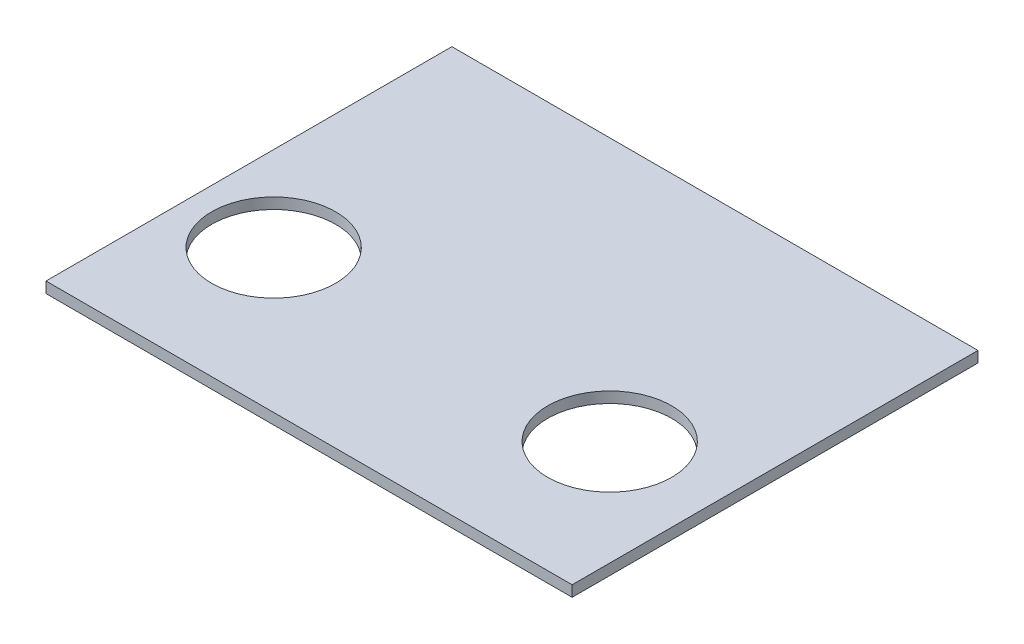
from build123d import *

# Parameters (mm, degrees)
ESQUISSE1_W             = 70
ESQUISSE1_H             = 54
BOSS_EXTRU_1_DEPTH      = 1.45
ESQUISSE2_R             = 8.25
ENL_V_MAT_EXTRU_1_DEPTH = 10
ESQUISSE4_R             = 8.25
ENL_V_MAT_EXTRU_3_DEPTH = 10


with BuildPart() as part:
    # Esquisse1 → Boss.-Extru.1 (new body)
    with BuildSketch(Plane(origin=(0, 0, 0), x_dir=(1, 0, 0), z_dir=(0, 1, 0))):
        Rectangle(ESQUISSE1_W, ESQUISSE1_H)
    extrude(amount=BOSS_EXTRU_1_DEPTH)

    # Esquisse2 → Enlèv. mat.-Extru.1 (cut)
    with BuildSketch(Plane(origin=(0, 1.45, 0), x_dir=(1, 0, 0), z_dir=(0, 1, 0))):
        with Locations((-23.710505548, -8)):
            Circle(ESQUISSE2_R)
    extrude(amount=-ENL_V_MAT_EXTRU_1_DEPTH, mode=Mode.SUBTRACT)

    # Esquisse4 → Enlèv. mat.-Extru.3 (cut)
    with BuildSketch(Plane(origin=(0, 1.45, 0), x_dir=(1, 0, 0), z_dir=(0, 1, 0))):
        with Locations((21, -8)):
            Circle(ESQUISSE4_R)
    extrude(amount=-ENL_V_MAT_EXTRU_3_DEPTH, mode=Mode.SUBTRACT)


solid = part.part
